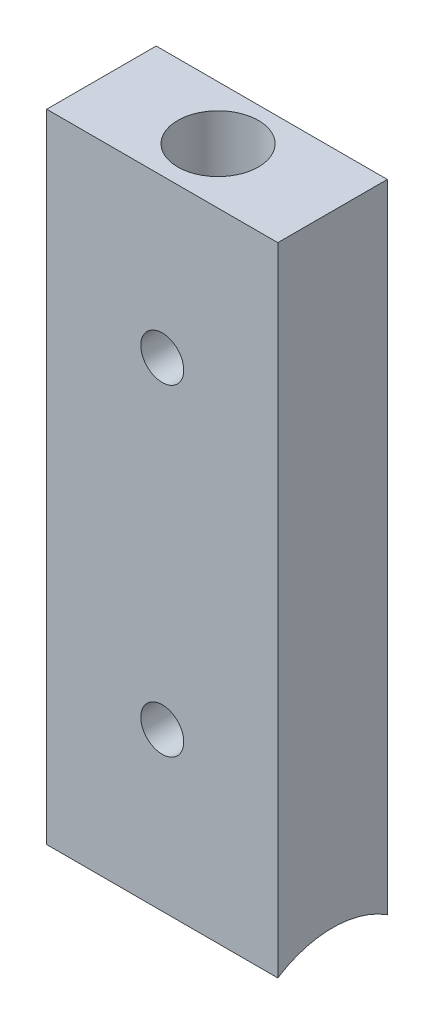
from build123d import *

# Parameters (mm, degrees)
SKETCH1_W           = 21.53
SKETCH1_H           = 59.33
BOSS_EXTRUDE1_DEPTH = 10.2
SKETCH2_R           = 3.76
CUT_EXTRUDE1_DEPTH  = 10
CUT_EXTRUDE2_REACH  = 40.047
CUT_EXTRUDE3_REACH  = 35.165
SKETCH4_R           = 2


with BuildPart() as part:
    # Sketch1 → Boss-Extrude1 (new body)
    with BuildSketch(Plane.XY):
        Rectangle(SKETCH1_W, SKETCH1_H)
    extrude(amount=BOSS_EXTRUDE1_DEPTH)

    # Sketch2 → Cut-Extrude1 (cut)
    with BuildSketch(Plane(origin=(0, 29.665, 0), x_dir=(1, 0, 0), z_dir=(0, 1, 0))):
        with Locations((0, -5)):
            Circle(SKETCH2_R)
    extrude(amount=-CUT_EXTRUDE1_DEPTH, mode=Mode.SUBTRACT)

    # Sketch3 → Cut-Extrude2 (cut, up to next)
    with BuildSketch(Plane(origin=(10.765, 0, 0), x_dir=(0, 0, -1), z_dir=(1, 0, 0)), mode=Mode.PRIVATE) as cut_extrude2_sk1:
        with BuildLine():
            Line((-10.2, -29.665), (0, -29.665))
            ThreePointArc((0, -29.665), (-5.1, -28.160483836), (-10.2, -29.665))
        make_face()
    cut_extrude2_tool1 = extrude(cut_extrude2_sk1.sketch, amount=-CUT_EXTRUDE2_REACH, mode=Mode.PRIVATE) & part.part
    add(cut_extrude2_tool1.solids().sort_by_distance((10.765, -29.058863, 5.1))[0], mode=Mode.SUBTRACT)

    # Sketch4 → Cut-Extrude3 (cut, up to next)
    with BuildSketch(Plane.XY.offset(10.2), mode=Mode.PRIVATE) as cut_extrude3_sk1:
        with Locations((0, 15)):
            Circle(SKETCH4_R)
    cut_extrude3_tool1 = extrude(cut_extrude3_sk1.sketch, amount=-CUT_EXTRUDE3_REACH, mode=Mode.PRIVATE) & part.part
    # Sketch4 → Cut-Extrude3 (cut, up to next)
    with BuildSketch(Plane.XY.offset(10.2), mode=Mode.PRIVATE) as cut_extrude3_sk2:
        with Locations((0, -15)):
            Circle(SKETCH4_R)
    cut_extrude3_tool2 = extrude(cut_extrude3_sk2.sketch, amount=-CUT_EXTRUDE3_REACH, mode=Mode.PRIVATE) & part.part
    add(cut_extrude3_tool1.solids().sort_by_distance((0, 15, 10.2))[0], mode=Mode.SUBTRACT)
    add(cut_extrude3_tool2.solids().sort_by_distance((0, -15, 10.2))[0], mode=Mode.SUBTRACT)


solid = part.part
